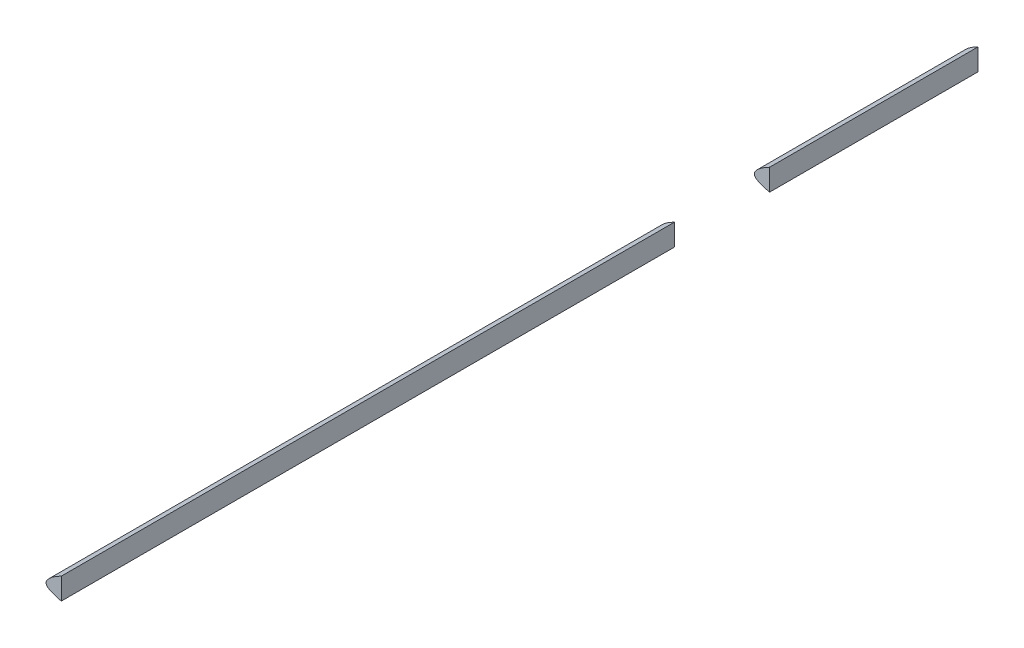
from build123d import *

# Parameters (mm, degrees)
BOSS_EXTRUDE2_START = -761.999746
BOSS_EXTRUDE2_DEPTH = 761.999746
CUT_EXTRUDE1_START  = -761.999746
CUT_EXTRUDE1_DEPTH  = 761.999746
SKETCH3_W           = 79.022194
SKETCH3_H           = 17.993123344
CUT_EXTRUDE2_DEPTH  = 12.7


# Read off the part's stored shape, not the designer's step: Cut-Extrude1
with BuildPart() as part:
    # Sketch2 → Boss-Extrude2 (new body)
    with BuildSketch(Plane.XY.offset(BOSS_EXTRUDE2_START)):
        with BuildLine():
            add(Edge.make_bspline(
                [(324.902693551, 0), (324.903463196, 0.023313358), (322.493960125, 0.266874853), (320.107118726, 0.728898482), (314.479929879, 1.696599545), (307.761979309, 2.966510847), (299.156213966, 4.44402059), (289.108994082, 6.054587212), (277.614504557, 7.858625418), (264.867967682, 9.828639283), (251.037893607, 11.946456865), (236.320520328, 14.162828682), (220.915494029, 16.434797842), (205.033677241, 18.716292105), (188.883341887, 20.922988597), (172.682407247, 22.997310524), (156.622614565, 24.830178487), (140.850407651, 26.262579625), (125.478771128, 27.205045845), (110.596641232, 27.609413226), (96.285303339, 27.444653165), (82.616452357, 26.722177249), (69.668434964, 25.464252485), (57.528852266, 23.789075325), (46.305668853, 21.755773795), (36.112498821, 19.421560607), (27.045487678, 16.846978605), (19.196955025, 14.082419467), (12.619518254, 11.195340149), (7.393829249, 8.273577005), (3.466455599, 5.362609604), (1.07214418, 2.697450283), (-0.443018312, -0.016380309), (1.142123289, -2.660381571), (4.36503606, -4.226764571), (8.971221404, -6.028809419), (15.243598774, -7.49562747), (23.03205608, -8.813433078), (32.324829104, -9.885015211), (43.025610851, -10.722004925), (55.037019029, -11.32133074), (68.234402161, -11.683120574), (82.476890937, -11.821694636), (97.60585357, -11.731263556), (113.468681032, -11.414630367), (129.930020513, -10.79847052), (146.859715047, -9.938801137), (164.102555428, -8.954688629), (181.455347718, -7.914187903), (198.694582839, -6.86098311), (215.596359861, -5.836960409), (231.942646987, -4.863457625), (247.517899408, -3.967162621), (262.118380872, -3.157120583), (275.542852028, -2.445675428), (287.622696903, -1.835678138), (298.158964313, -1.306811978), (307.16541669, -0.826816664), (314.173983408, -0.368946975), (319.99978897, -0.117218531), (322.45689994, 0.039112512), (324.901921434, -0.023388259), (324.902693551, 0)],
                knots=[0, 0, 0, 0, 0.001748082, 0.006827365, 0.014880219, 0.025572325, 0.038694157, 0.05417078, 0.071834092, 0.091434533, 0.112684614, 0.135293129, 0.158943981, 0.183314993, 0.208069947, 0.232879416, 0.257398767, 0.281383633, 0.304705763, 0.327241497, 0.348896563, 0.36960694, 0.389308376, 0.407885696, 0.425177149, 0.44102679, 0.455299972, 0.467903885, 0.478751648, 0.487814349, 0.495090031, 0.500616983, 0.504451368, 0.507803776, 0.513091193, 0.520546229, 0.530249123, 0.542213645, 0.556382479, 0.572655502, 0.590894529, 0.610925387, 0.632535859, 0.655496365, 0.679547083, 0.704498569, 0.730211425, 0.756435525, 0.782836661, 0.80906245, 0.834775916, 0.859641281, 0.883337827, 0.905540839, 0.925965139, 0.944326313, 0.960365877, 0.973929438, 0.984907697, 0.99311134, 0.998246302, 1, 1, 1, 1], degree=3))
        make_face()
    extrude(amount=BOSS_EXTRUDE2_DEPTH)

    # Cut-Extrude1 outline → Cut-Extrude1 (cut)
    with BuildSketch(Plane.XY.offset(CUT_EXTRUDE1_START)):
        with BuildLine():
            add(Edge.make_bspline(
                [(324.902693551, 0), (324.903463196, 0.023313358), (322.493960125, 0.266874853), (320.107118726, 0.728898482), (314.479929879, 1.696599545), (307.761979309, 2.966510847), (299.156213966, 4.44402059), (289.108994082, 6.054587212), (277.614504557, 7.858625418), (264.867967682, 9.828639283), (251.037893607, 11.946456865), (236.320520328, 14.162828682), (220.915494029, 16.434797842), (205.033677241, 18.716292105), (188.883341887, 20.922988597), (172.682407247, 22.997310524), (156.622614565, 24.830178487), (140.850407651, 26.262579625), (125.478771128, 27.205045845), (110.596641232, 27.609413226), (96.285303339, 27.444653165), (82.616452357, 26.722177249), (69.668434964, 25.464252485), (57.528852266, 23.789075325), (46.305668853, 21.755773795), (36.112498821, 19.421560607), (27.045487678, 16.846978605), (19.3313577, 14.129761328), (14.714314762, 12.114502523), (12.7, 11.117087729)],
                knots=[0, 0, 0, 0, 0.001748082, 0.006827365, 0.014880219, 0.025572325, 0.038694157, 0.05417078, 0.071834092, 0.091434533, 0.112684614, 0.135293129, 0.158943981, 0.183314993, 0.208069947, 0.232879416, 0.257398767, 0.281383633, 0.304705763, 0.327241497, 0.348896563, 0.36960694, 0.389308376, 0.407885696, 0.425177149, 0.44102679, 0.455299972, 0.467903885, 0.478105627, 0.478105627, 0.478105627, 0.478105627], degree=3))
            Line((12.7, 11.117087729), (12.7, -6.876035615))
            add(Edge.make_bspline(
                [(12.7, -6.876035615), (13.386291094, -7.033779246), (16.659123202, -7.735133954), (23.03205608, -8.813433078), (32.324829104, -9.885015211), (43.025610851, -10.722004925), (55.037019029, -11.32133074), (68.234402161, -11.683120574), (82.476890937, -11.821694636), (97.60585357, -11.731263556), (113.468681032, -11.414630367), (129.930020513, -10.79847052), (146.859715047, -9.938801137), (164.102555428, -8.954688629), (181.455347718, -7.914187903), (198.694582839, -6.86098311), (215.596359861, -5.836960409), (231.942646987, -4.863457625), (247.517899408, -3.967162621), (262.118380872, -3.157120583), (275.542852028, -2.445675428), (287.622696903, -1.835678138), (298.158964313, -1.306811978), (307.16541669, -0.826816664), (314.173983408, -0.368946975), (319.99978897, -0.117218531), (322.45689994, 0.039112512), (324.901921434, -0.023388259), (324.902693551, 0)],
                knots=[0.52705934, 0.52705934, 0.52705934, 0.52705934, 0.530249123, 0.542213645, 0.556382479, 0.572655502, 0.590894529, 0.610925387, 0.632535859, 0.655496365, 0.679547083, 0.704498569, 0.730211425, 0.756435525, 0.782836661, 0.80906245, 0.834775916, 0.859641281, 0.883337827, 0.905540839, 0.925965139, 0.944326313, 0.960365877, 0.973929438, 0.984907697, 0.99311134, 0.998246302, 1, 1, 1, 1], degree=3))
        make_face()
    extrude(amount=CUT_EXTRUDE1_DEPTH, mode=Mode.SUBTRACT)

    # Sketch3 → Cut-Extrude2 (cut)
    with BuildSketch(Plane.ZY):
        with Locations((-549.204261, 2.120526057)):
            Rectangle(SKETCH3_W, SKETCH3_H)
    extrude(amount=-CUT_EXTRUDE2_DEPTH, mode=Mode.SUBTRACT)


with BuildPart() as cut_extrude2_piece_1:
    # of the separate pieces the step leaves, piece 1, a body of its own (cut_extrude2_pieces)
    add(part.part.solids().sort_by_distance((12.7, 11.117087729, -509.693164))[0])


with BuildPart() as cut_extrude2_piece_2:
    # of the separate pieces the step leaves, piece 2, a body of its own (cut_extrude2_pieces)
    add(part.part.solids().sort_by_distance((12.7, 11.117087729, -761.999746))[0])


solid = Compound([cut_extrude2_piece_1.part, cut_extrude2_piece_2.part])
